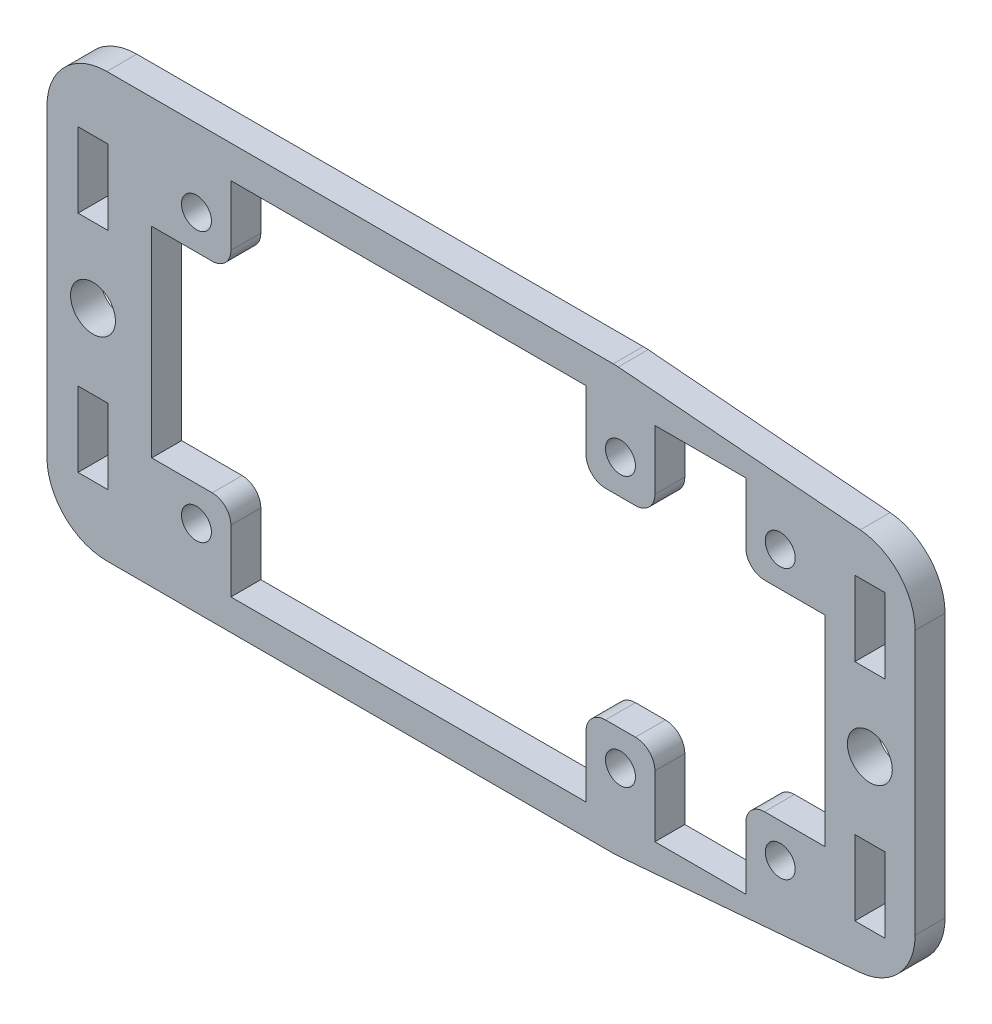
from build123d import *

# Parameters (mm, degrees)
BOSS_EXTRU_1_OUTLINE_W   = 2
BOSS_EXTRU_1_OUTLINE_H   = 5
BOSS_EXTRU_1_OUTLINE_R   = 1
BOSS_EXTRU_1_OUTLINE_R_2 = 1.5
BOSS_EXTRU_1_DEPTH       = 2
FILLET1_R                = 4


# Read off the part's stored shape, not the designer's step: Boss.-Extru.1
with BuildPart() as part:
    # Boss.-Extru.1 outline → Boss.-Extru.1 (new body)
    with BuildSketch(Plane.XY):
        Polygon((-7, -14.16114291), (31, -14.16114291), (51, -12.5), (51, 12.5), (31, 14.16114291), (-7, 14.16114291), align=None)
        with Locations((-3.924802108, -7.5)):
            Rectangle(BOSS_EXTRU_1_OUTLINE_W, BOSS_EXTRU_1_OUTLINE_H, mode=Mode.SUBTRACT)
        with Locations((2.98759897, -9.000034515)):
            Circle(BOSS_EXTRU_1_OUTLINE_R, mode=Mode.SUBTRACT)
        with Locations((31.315776387, -9.000034515)):
            Circle(BOSS_EXTRU_1_OUTLINE_R, mode=Mode.SUBTRACT)
        with Locations((41.98759897, -9.000034515)):
            Circle(BOSS_EXTRU_1_OUTLINE_R, mode=Mode.SUBTRACT)
        with Locations((47.975197892, -7.5)):
            Rectangle(BOSS_EXTRU_1_OUTLINE_W, BOSS_EXTRU_1_OUTLINE_H, mode=Mode.SUBTRACT)
        with BuildLine():
            ThreePointArc((33.615776345, -8.000034132), (33.23501504, -7.080795537), (32.315776344, -6.700034473))
            Line((32.315776344, -6.700034473), (30.315776345, -6.700034473))
            ThreePointArc((30.315776345, -6.700034473), (29.396536008, -7.080797161), (29.015776303, -8.000038733))
            Line((29.015776303, -8.000038733), (29.015776303, -12.100034515))
            Line((29.015776303, -12.100034515), (5.28759897, -12.100034515))
            Line((5.28759897, -12.100034515), (5.28759897, -7.950034515))
            ThreePointArc((5.28759897, -7.950034515), (4.921479782, -7.066148374), (4.037591434, -6.700034515))
            Line((4.037591434, -6.700034515), (0, -6.699965485))
            Line((0, -6.699965485), (0, 6.699965485))
            Line((0, 6.699965485), (4.03758425, 6.699965485))
            ThreePointArc((4.03758425, 6.699965485), (4.921477242, 7.066076805), (5.28759897, 7.949965485))
            Line((5.28759897, 7.949965485), (5.28759897, 11.987564455))
            Line((5.28759897, 11.987564455), (29.015776399, 11.987564455))
            Line((29.015776399, 11.987564455), (29.015776399, 7.999965373))
            ThreePointArc((29.015776399, 7.999965373), (29.396537621, 7.080726637), (30.31577639, 6.699965495))
            Line((30.31577639, 6.699965495), (32.315776389, 6.699965495))
            ThreePointArc((32.315776389, 6.699965495), (33.235016597, 7.080728053), (33.615776432, 7.999969389))
            Line((33.615776432, 7.999969389), (33.615776432, 11.987564455))
            Line((33.615776432, 11.987564455), (39.68759897, 11.987564455))
            Line((39.68759897, 11.987564455), (39.68759897, 7.949965701))
            ThreePointArc((39.68759897, 7.949965701), (40.053716981, 7.066080502), (40.9376034, 6.699965437))
            Line((40.9376034, 6.699965437), (44.975197892, 6.699965437))
            Line((44.975197892, 6.699965437), (44.975197892, -6.70003437))
            Line((44.975197892, -6.70003437), (40.937599481, -6.70003437))
            ThreePointArc((40.937599481, -6.70003437), (40.053713738, -7.066152541), (39.687598777, -7.950039613))
            Line((39.687598777, -7.950039613), (39.687598777, -12.100034515))
            Line((39.687598777, -12.100034515), (33.615776345, -12.100034515))
            Line((33.615776345, -12.100034515), (33.615776345, -8.000034132))
        make_face(mode=Mode.SUBTRACT)
        with Locations((-3.924802108, 0)):
            Circle(BOSS_EXTRU_1_OUTLINE_R_2, mode=Mode.SUBTRACT)
        with Locations((-3.924802108, 7.5)):
            Rectangle(BOSS_EXTRU_1_OUTLINE_W, BOSS_EXTRU_1_OUTLINE_H, mode=Mode.SUBTRACT)
        with Locations((2.98759897, 8.999965485)):
            Circle(BOSS_EXTRU_1_OUTLINE_R, mode=Mode.SUBTRACT)
        with Locations((47.975197892, 0)):
            Circle(BOSS_EXTRU_1_OUTLINE_R_2, mode=Mode.SUBTRACT)
        with Locations((31.315776387, 8.999965485)):
            Circle(BOSS_EXTRU_1_OUTLINE_R, mode=Mode.SUBTRACT)
        with Locations((41.98759897, 8.999965485)):
            Circle(BOSS_EXTRU_1_OUTLINE_R, mode=Mode.SUBTRACT)
        with Locations((47.975197892, 7.5)):
            Rectangle(BOSS_EXTRU_1_OUTLINE_W, BOSS_EXTRU_1_OUTLINE_H, mode=Mode.SUBTRACT)
    extrude(amount=BOSS_EXTRU_1_DEPTH)

    # Fillet1
    # the kernel refuses this fillet: 4 mm, written as the material it takes off along each edge
    with BuildSketch(Plane(origin=(31, -14.16114291, -0.414571976), x_dir=(-1, 0, 0), z_dir=(0, 0, 1)), Plane(origin=(31, 14.16114291, -0.414571976), x_dir=(0.9965684992480803, -0.0827721348427634, 0), z_dir=(0, 0, 1))) as fillet1_piece_1:
        with BuildLine():
            CenterArc((FILLET1_R * 0.0414571976238, -FILLET1_R), FILLET1_R, 90, 4.747926068)
            Line((-FILLET1_R * 0.041314937219, -FILLET1_R * 0.00343150075192), (0, 0))
            Line((0, 0), (FILLET1_R * 0.0414571976238, 0))
        make_face()
    extrude(amount=2.829143952, mode=Mode.SUBTRACT)
    with BuildSketch(Plane(origin=(-7, -14.16114291, -10), x_dir=(1, 0, 0), z_dir=(0, 0, 1))) as fillet1_piece_2:
        with BuildLine():
            CenterArc((FILLET1_R, FILLET1_R), FILLET1_R, 180, 90)
            Line((0, FILLET1_R), (0, 0))
            Line((0, 0), (FILLET1_R, 0))
        make_face()
    extrude(amount=22, mode=Mode.SUBTRACT)
    with BuildSketch(Plane(origin=(-7, 14.16114291, -10), x_dir=(1, 0, 0), z_dir=(0, 0, 1))) as fillet1_piece_3:
        with BuildLine():
            CenterArc((FILLET1_R, -FILLET1_R), FILLET1_R, 90, 90)
            Line((0, -FILLET1_R), (0, 0))
            Line((0, 0), (FILLET1_R, 0))
        make_face()
    extrude(amount=22, mode=Mode.SUBTRACT)
    with BuildSketch(Plane(origin=(51, 12.5, -9.20386171), x_dir=(0, -1, 0), z_dir=(0, 0, 1)), Plane(origin=(51, -12.5, -9.20386171), x_dir=(-0.9965684992480804, -0.08277213484276448, 0), z_dir=(0, 0, 1))) as fillet1_piece_4:
        with BuildLine():
            CenterArc((FILLET1_R * 0.920386170995, -FILLET1_R), FILLET1_R, 90, 85.252073932)
            Line((-FILLET1_R * 0.076182328253, -FILLET1_R * 0.917227865157), (0, 0))
            Line((0, 0), (FILLET1_R * 0.920386170995, 0))
        make_face()
    extrude(amount=20.40772342, mode=Mode.SUBTRACT)


solid = part.part
